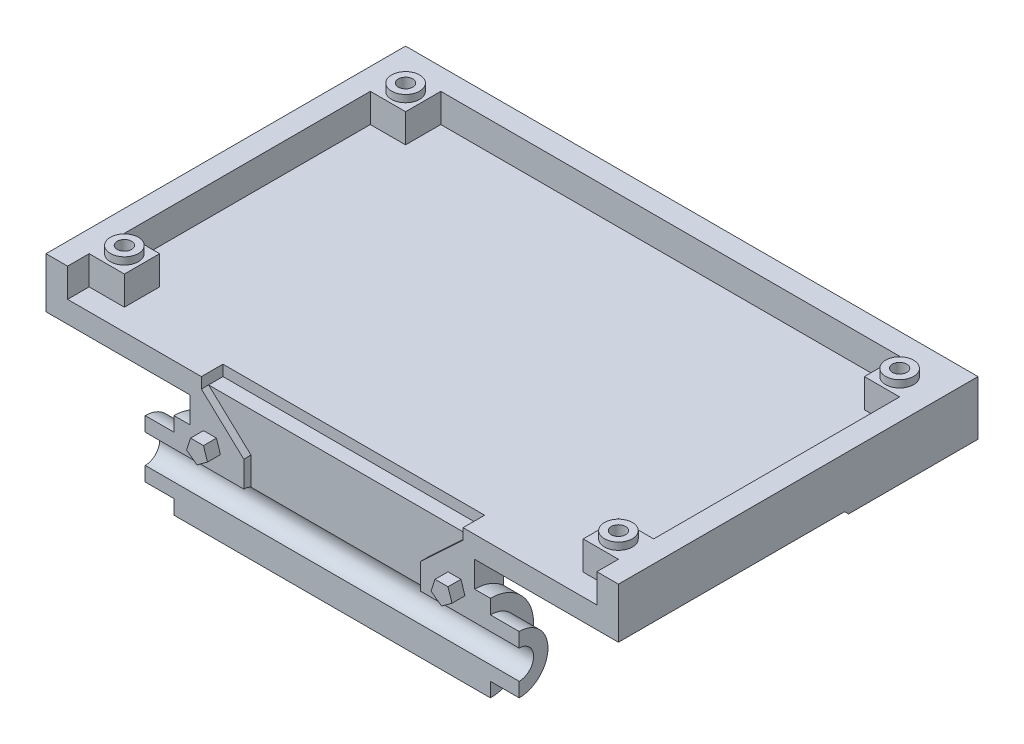
from build123d import *

# Parameters (mm, degrees)
IZIM2_W                          = 40
IZIM2_H                          = 16
Y_KSEKLIK_EKSTR_ZYON4_DEPTH      = 9
Y_KSEKLIK_EKSTR_ZYON5_DEPTH      = 2
Y_KSEKLIK_EKSTR_ZYON5_DEPTH_BACK = 42
Y_KSEKLIK_EKSTR_ZYON6_DEPTH      = 6
Y_KSEKLIK_EKSTR_ZYON6_DEPTH_BACK = 46
KES_EKSTR_ZYON1_DEPTH            = 52
KES_EKSTR_ZYON2_DEPTH            = 53.347615077
KES_EKSTR_ZYON2_DEPTH_BACK       = 52
IZIM3_4_W                        = 9
IZIM3_4_H                        = 16
Y_KSEKLIK_EKSTR_ZYON7_DEPTH      = 44
KES_EKSTR_ZYON4_DEPTH            = 44
KES_EKSTR_ZYON8_DEPTH            = 2.2
KES_EKSTR_ZYON9_DEPTH            = 2.2
IZIM14_W                         = 39.6
IZIM14_H                         = 3
ARALIK_EKS_DEPTH                 = 0.6
Y_KSEKLIK_EKSTR_ZYON9_DEPTH      = 7
Y_KSEKLIK_EKSTR_ZYON11_DEPTH     = 47
IZIM17_W                         = 73.6
IZIM17_H                         = 4
KES_EKSTR_ZYON10_DEPTH           = 10
IZIM18_W                         = 4.9
IZIM18_H                         = 4.9
IZIM18_R                         = 1.95
Y_KSEKLIK_EKSTR_ZYON12_DEPTH     = 4
IZIM18_3_R                       = 1.95
IZIM18_3_R_2                     = 1
Y_KSEKLIK_EKSTR_ZYON13_DEPTH     = 5
IZIM18_4_R                       = 1
KES_EKSTR_ZYON11_DEPTH           = 7
KES_EKSTR_ZYON12_DEPTH           = 1
IZIM21_W                         = 36.385714286
IZIM21_H                         = 1.5
KES_EKSTR_ZYON13_DEPTH           = 3
Y_KSEKLIK_EKSTR_ZYON14_DEPTH     = 1.8
Y_KSEKLIK_EKSTR_ZYON15_DEPTH     = 0.55
PAH1_SIZE                        = 1


with BuildPart() as part:
    # Çizim2 → Yükseklik-Ekstrüzyon4 (new body)
    with BuildSketch(Plane.XY):
        with Locations((-27.243761407, 15.308213235)):
            Rectangle(IZIM2_W, IZIM2_H)
    extrude(amount=Y_KSEKLIK_EKSTR_ZYON4_DEPTH)

    # Çizim3 → Yükseklik-Ekstrüzyon5 (add, two sides: drawn at the far end of the back side and taken through both)
    with BuildSketch(Plane(origin=(-7.243761407, 0, 0), x_dir=(0, 0, -1), z_dir=(1, 0, 0)).offset(-Y_KSEKLIK_EKSTR_ZYON5_DEPTH_BACK)):
        with BuildLine():
            ThreePointArc((-9, 9.308213235), (-3, 15.308213235), (-9, 21.308213235))
            Line((-9, 21.308213235), (-9, 19.308213235))
            ThreePointArc((-9, 19.308213235), (-5, 15.308213235), (-9, 11.308213235))
            Line((-9, 11.308213235), (-9, 9.308213235))
        make_face()
    extrude(amount=Y_KSEKLIK_EKSTR_ZYON5_DEPTH + Y_KSEKLIK_EKSTR_ZYON5_DEPTH_BACK)

    # Çizim3<3> → Yükseklik-Ekstrüzyon6 (add, two sides: drawn at the far end of the back side and taken through both)
    with BuildSketch(Plane(origin=(-7.243761407, 0, 0), x_dir=(0, 0, -1), z_dir=(1, 0, 0)).offset(-Y_KSEKLIK_EKSTR_ZYON6_DEPTH_BACK)):
        with BuildLine():
            ThreePointArc((-9, 11.308213235), (-5, 15.308213235), (-9, 19.308213235))
            Line((-9, 19.308213235), (-9, 11.308213235))
        make_face()
    extrude(amount=Y_KSEKLIK_EKSTR_ZYON6_DEPTH + Y_KSEKLIK_EKSTR_ZYON6_DEPTH_BACK)

    # Çizim4 → Kes-Ekstrüzyon1 (cut)
    with BuildSketch(Plane(origin=(-1.243761407, 0, 0), x_dir=(0, 0, -1), z_dir=(1, 0, 0))):
        with BuildLine():
            Line((-9, 17.308213235), (-9, 13.308213235))
            ThreePointArc((-9, 13.308213235), (-7, 15.308213235), (-9, 17.308213235))
        make_face()
    extrude(amount=-KES_EKSTR_ZYON1_DEPTH, mode=Mode.SUBTRACT)

    # Çizim3<4> → Kes-Ekstrüzyon2 (cut, two sides: drawn at the far end of the back side and taken through both)
    with BuildSketch(Plane(origin=(-7.243761407, 0, 0), x_dir=(0, 0, -1), z_dir=(1, 0, 0)).offset(-KES_EKSTR_ZYON2_DEPTH_BACK)):
        with Locations((-4.5, 15.308213235)):
            Rectangle(IZIM3_4_W, IZIM3_4_H)
        with BuildLine():
            ThreePointArc((-9, 9.308213235), (-3, 15.308213235), (-9, 21.308213235))
            Line((-9, 21.308213235), (-9, 9.308213235))
        make_face(mode=Mode.SUBTRACT)
    extrude(amount=KES_EKSTR_ZYON2_DEPTH + KES_EKSTR_ZYON2_DEPTH_BACK, mode=Mode.SUBTRACT)


with BuildPart() as kes_ekstr_zyon2_kept_piece:
    # of the separate pieces the step leaves, the one the design keeps (kes_ekstr_zyon2_pieces_kept)
    add(part.part.solids().sort_by_distance((-49.243761407, 9.308213235, 9))[0])

    # Çizim7 → Yükseklik-Ekstrüzyon7 (add)
    with BuildSketch(Plane(origin=(-5.243761407, 0, 0), x_dir=(0, 0, -1), z_dir=(1, 0, 0))):
        with BuildLine():
            Line((-5, 19.78034919), (-5, 24.308213235))
            Line((-5, 24.308213235), (-9, 24.308213235))
            Line((-9, 24.308213235), (-9, 21.308213235))
            ThreePointArc((-9, 21.308213235), (-6.859067461, 20.913247389), (-5, 19.78034919))
        make_face()
    extrude(amount=-Y_KSEKLIK_EKSTR_ZYON7_DEPTH)

    # Çizim8 → Kes-Ekstrüzyon4 (cut)
    with BuildSketch(Plane.XY.offset(9)):
        Polygon((-7.443761407, 24.308213235), (-7.443761407, 21.308213235), (-5.243761407, 21.308213235), (-5.243761407, 22.308213235), (-5.243761407, 24.308213235), align=None)
        Polygon((-49.243761407, 24.308213235), (-47.043761407, 24.308213235), (-47.043761407, 21.308213235), (-49.243761407, 21.308213235), (-49.243761407, 22.308213235), align=None)
    extrude(amount=-KES_EKSTR_ZYON4_DEPTH, mode=Mode.SUBTRACT)

    # Çizim7<3> → Kes-Ekstrüzyon8 (cut)
    with BuildSketch(Plane(origin=(-5.243761407, 0, 0), x_dir=(0, 0, -1), z_dir=(1, 0, 0))):
        with BuildLine():
            Line((-5, 19.78034919), (-5, 24.308213235))
            Line((-5, 24.308213235), (-9, 24.308213235))
            Line((-9, 24.308213235), (-9, 21.308213235))
            ThreePointArc((-9, 21.308213235), (-6.859067461, 20.913247389), (-5, 19.78034919))
        make_face()
    extrude(amount=-KES_EKSTR_ZYON8_DEPTH, mode=Mode.SUBTRACT)

    # Çizim12 → Kes-Ekstrüzyon9 (cut)
    with BuildSketch(Plane.ZY.offset(49.243761407)):
        with BuildLine():
            Line((5, 19.78034919), (5, 21.308213235))
            Line((5, 21.308213235), (9, 21.308213235))
            ThreePointArc((9, 21.308213235), (6.859067461, 20.913247389), (5, 19.78034919))
        make_face()
    extrude(amount=-KES_EKSTR_ZYON9_DEPTH, mode=Mode.SUBTRACT)

    # Çizim14 → aralik_eks (add)
    with BuildSketch(Plane(origin=(0, 24.308213235, 0), x_dir=(1, 0, 0), z_dir=(0, 1, 0))):
        with Locations((-27.243761407, -7.5)):
            Rectangle(IZIM14_W, IZIM14_H)
    extrude(amount=ARALIK_EKS_DEPTH)

    # Çizim15 → Yükseklik-Ekstrüzyon9 (add)
    with BuildSketch(Plane(origin=(0, 24.908213235, 0), x_dir=(1, 0, 0), z_dir=(0, 1, 0))):
        Polygon((-47.043761407, -6), (-67.043761407, -6), (-67.043761407, -9), (-47.043761407, -9), (-7.443761407, -9), (12.556238593, -9), (12.556238593, -6), (-7.443761407, -6), align=None)
    extrude(amount=Y_KSEKLIK_EKSTR_ZYON9_DEPTH)

    # Çizim16 → Yükseklik-Ekstrüzyon11 (add)
    with BuildSketch(Plane(origin=(0, 0, 6), x_dir=(-1, 0, 0), z_dir=(0, 0, -1))):
        Polygon((-12.556238593, 24.908213235), (-12.556238593, 31.908213235), (-9.556238593, 31.908213235), (-9.556238593, 27.908213235), (64.043761407, 27.908213235), (64.043761407, 31.908213235), (67.043761407, 31.908213235), (67.043761407, 24.908213235), align=None)
    extrude(amount=Y_KSEKLIK_EKSTR_ZYON11_DEPTH)

    # Çizim17 → Kes-Ekstrüzyon10 (cut)
    with BuildSketch(Plane(origin=(0, 0, 6), x_dir=(-1, 0, 0), z_dir=(0, 0, -1))):
        with Locations((27.243761407, 29.908213235)):
            Rectangle(IZIM17_W, IZIM17_H)
    extrude(amount=-KES_EKSTR_ZYON10_DEPTH, mode=Mode.SUBTRACT)

    # Çizim18 → Yükseklik-Ekstrüzyon12 (add)
    # profile 1 of 5: a face of its own
    with BuildSketch(Plane(origin=(0, 27.908213235, 0), x_dir=(1, 0, 0), z_dir=(0, 1, 0))):
        with Locations((7.106238593, 35.55)):
            Rectangle(IZIM18_W, IZIM18_H)
        with Locations(Location((7.106238593, 35.55, 0), (0, 0, 270))):
            Circle(IZIM18_R, mode=Mode.SUBTRACT)
    # profile 2 of 5: a face of its own
    with BuildSketch(Plane(origin=(0, 27.908213235, 0), x_dir=(1, 0, 0), z_dir=(0, 1, 0))):
        with Locations((-61.593761407, 35.55)):
            Rectangle(IZIM18_W, IZIM18_H)
        with Locations(Location((-61.593761407, 35.55, 0), (0, 0, 270))):
            Circle(IZIM18_R, mode=Mode.SUBTRACT)
    # profile 3 of 5: a face of its own
    with BuildSketch(Plane(origin=(0, 27.908213235, 0), x_dir=(1, 0, 0), z_dir=(0, 1, 0))):
        Polygon((9.556238593, 41), (-64.043761407, 41), (-64.043761407, 38), (-59.143761407, 38), (4.656238593, 38), (9.556238593, 38), align=None)
    # profile 4 of 5: a face of its own
    with BuildSketch(Plane(origin=(0, 27.908213235, 0), x_dir=(1, 0, 0), z_dir=(0, 1, 0))):
        with Locations((-61.593761407, -3.55)):
            Rectangle(IZIM18_W, IZIM18_H)
        with Locations(Location((-61.593761407, -3.55, 0), (0, 0, 270))):
            Circle(IZIM18_R, mode=Mode.SUBTRACT)
    # profile 5 of 5: a face of its own
    with BuildSketch(Plane(origin=(0, 27.908213235, 0), x_dir=(1, 0, 0), z_dir=(0, 1, 0))):
        with Locations((7.106238593, -3.55)):
            Rectangle(IZIM18_W, IZIM18_H)
        with Locations(Location((7.106238593, -3.55, 0), (0, 0, 270))):
            Circle(IZIM18_R, mode=Mode.SUBTRACT)
    extrude(amount=Y_KSEKLIK_EKSTR_ZYON12_DEPTH)

    # Çizim18<3> → Yükseklik-Ekstrüzyon13 (add)
    # profile 1 of 4: a face of its own
    with BuildSketch(Plane(origin=(0, 27.908213235, 0), x_dir=(1, 0, 0), z_dir=(0, 1, 0))):
        with Locations(Location((-61.593761407, 35.55, 0), (0, 0, 270))):
            Circle(IZIM18_3_R)
        with Locations(Location((-61.593761407, 35.55, 0), (0, 0, 270))):
            Circle(IZIM18_3_R_2, mode=Mode.SUBTRACT)
    # profile 2 of 4: a face of its own
    with BuildSketch(Plane(origin=(0, 27.908213235, 0), x_dir=(1, 0, 0), z_dir=(0, 1, 0))):
        with Locations(Location((7.106238593, 35.55, 0), (0, 0, 270))):
            Circle(IZIM18_3_R)
        with Locations(Location((7.106238593, 35.55, 0), (0, 0, 270))):
            Circle(IZIM18_3_R_2, mode=Mode.SUBTRACT)
    # profile 3 of 4: a face of its own
    with BuildSketch(Plane(origin=(0, 27.908213235, 0), x_dir=(1, 0, 0), z_dir=(0, 1, 0))):
        with Locations(Location((7.106238593, -3.55, 0), (0, 0, 270))):
            Circle(IZIM18_3_R)
        with Locations(Location((7.106238593, -3.55, 0), (0, 0, 270))):
            Circle(IZIM18_3_R_2, mode=Mode.SUBTRACT)
    # profile 4 of 4: a face of its own
    with BuildSketch(Plane(origin=(0, 27.908213235, 0), x_dir=(1, 0, 0), z_dir=(0, 1, 0))):
        with Locations(Location((-61.593761407, -3.55, 0), (0, 0, 270))):
            Circle(IZIM18_3_R)
        with Locations(Location((-61.593761407, -3.55, 0), (0, 0, 270))):
            Circle(IZIM18_3_R_2, mode=Mode.SUBTRACT)
    extrude(amount=Y_KSEKLIK_EKSTR_ZYON13_DEPTH)

    # Çizim18<4> → Kes-Ekstrüzyon11 (cut)
    with BuildSketch(Plane(origin=(0, 27.908213235, 0), x_dir=(1, 0, 0), z_dir=(0, 1, 0))):
        with Locations(Location((-61.593761407, -3.55, 0), (0, 0, 270))):
            Circle(IZIM18_4_R)
        with Locations(Location((-61.593761407, 35.55, 0), (0, 0, 270))):
            Circle(IZIM18_4_R)
        with Locations(Location((7.106238593, 35.55, 0), (0, 0, 270))):
            Circle(IZIM18_4_R)
        with Locations(Location((7.106238593, -3.55, 0), (0, 0, 270))):
            Circle(IZIM18_4_R)
    extrude(amount=-KES_EKSTR_ZYON11_DEPTH, mode=Mode.SUBTRACT)

    # Çizim19 → Kes-Ekstrüzyon12 (cut)
    with BuildSketch(Plane.XY.offset(9)):
        Polygon((-45.43661855, 26.408213235), (-39.543761407, 20.908213235), (-39.543761407, 15.034084551), (-14.943761407, 15.034084551), (-14.943761407, 20.908213235), (-9.050904264, 26.408213235), align=None)
    extrude(amount=-KES_EKSTR_ZYON12_DEPTH, mode=Mode.SUBTRACT)

    # Çizim21 → Kes-Ekstrüzyon13 (cut)
    with BuildSketch(Plane.XY.offset(9)):
        with Locations((-27.243761407, 27.158213235)):
            Rectangle(IZIM21_W, IZIM21_H)
    extrude(amount=-KES_EKSTR_ZYON13_DEPTH, mode=Mode.SUBTRACT)

    # Çizim22 → Yükseklik-Ekstrüzyon14 (add)
    with BuildSketch(Plane.XY.offset(9)):
        Polygon((-44.243761407, 18.77704178), (-45.699991997, 19.835055235), (-45.143761407, 21.546956964), (-43.343761407, 21.546956964), (-42.787530817, 19.835055235), align=None)
        Polygon((-11.143761407, 21.546956964), (-11.699991997, 19.835055235), (-10.243761407, 18.77704178), (-8.787530817, 19.835055235), (-9.343761407, 21.546956964), align=None)
    extrude(amount=Y_KSEKLIK_EKSTR_ZYON14_DEPTH)

    # Çizim23 → Yükseklik-Ekstrüzyon15 (add)
    with BuildSketch(Plane.XZ.offset(-24.908213235)):
        Polygon((-67.043761407, -41), (12.556238593, -41), (12.556238593, -22), (11.556238593, -22), (11.556238593, -40), (-66.043761407, -40), (-66.043761407, -22), (-67.043761407, -22), align=None)
    extrude(amount=Y_KSEKLIK_EKSTR_ZYON15_DEPTH)

    # Pah1
    # the kernel refuses this chamfer: 1 mm, written as the material it takes off along each edge
    with BuildSketch(Plane(origin=(15.127921581, 24.358213235, -22), x_dir=(0, 0.9996219169112968, 0.027495876610585647), z_dir=(-1, 0, 0))) as pah1_piece_1_section:
        Polygon((PAH1_SIZE * 0.999621916911, PAH1_SIZE * 0.0274958766106), (-PAH1_SIZE * 0.0274958766106, PAH1_SIZE * 0.999621916911), (0, 0), align=None)
    pah1_piece_1 = extrude(amount=6.143365976, mode=Mode.PRIVATE)
    pah1_piece_1 = split(pah1_piece_1, bisect_by=Plane(origin=(12.056238593, 24.908213235, -22.383932074), z_dir=(0, -1, 0)), keep=Keep.TOP, mode=Mode.PRIVATE)
    add(pah1_piece_1, mode=Mode.SUBTRACT)
    with BuildSketch(Plane(origin=(-63.472078419, 24.358213235, -22), x_dir=(0, 0.9996219169112968, 0.027495876610585647), z_dir=(-1, 0, 0))) as pah1_piece_2_section:
        Polygon((PAH1_SIZE * 0.999621916911, PAH1_SIZE * 0.0274958766106), (-PAH1_SIZE * 0.0274958766106, PAH1_SIZE * 0.999621916911), (0, 0), align=None)
    pah1_piece_2 = extrude(amount=6.143365976, mode=Mode.PRIVATE)
    pah1_piece_2 = split(pah1_piece_2, bisect_by=Plane(origin=(-66.543761407, 24.908213235, -22.383932074), z_dir=(0, -1, 0)), keep=Keep.TOP, mode=Mode.PRIVATE)
    add(pah1_piece_2, mode=Mode.SUBTRACT)


solid = kes_ekstr_zyon2_kept_piece.part
